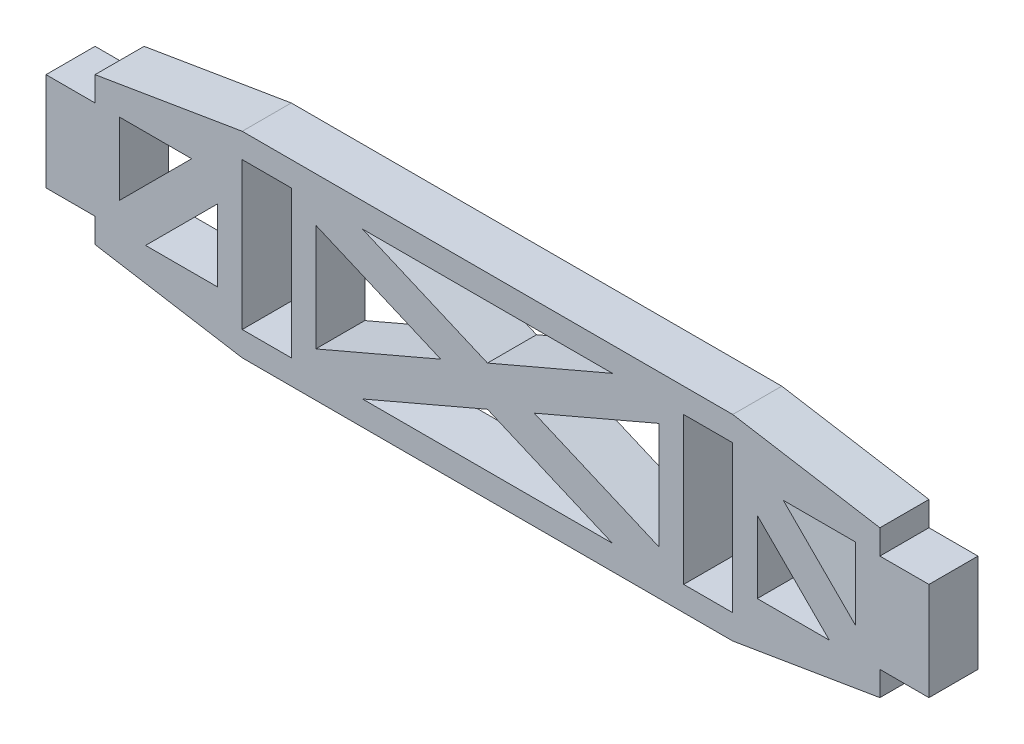
from build123d import *

# Parameters (mm, degrees)
SKETCH1_W           = 6.35
SKETCH1_H           = 19.05
BOSS_EXTRUDE1_DEPTH = 3.175
CUT_EXTRUDE1_DEPTH  = 59.887477446


with BuildPart() as part:
    # Sketch1 → Boss-Extrude1 (new, symmetric)
    with BuildSketch(Plane.XY):
        Polygon((-50.8, -9.525), (-50.8, -6.35), (-57.15, -6.35), (-57.15, 6.35), (-50.8, 6.35), (-50.8, 9.525), (-31.75, 12.7), (31.75, 12.7), (50.8, 9.525), (50.8, 6.35), (57.15, 6.35), (57.15, -6.35), (50.8, -6.35), (50.8, -9.525), (31.75, -12.7), (-31.75, -12.7), align=None)
        with Locations((-28.575, 0)):
            Rectangle(SKETCH1_W, SKETCH1_H, mode=Mode.SUBTRACT)
        with Locations((28.575, 0)):
            Rectangle(SKETCH1_W, SKETCH1_H, mode=Mode.SUBTRACT)
    extrude(amount=BOSS_EXTRUDE1_DEPTH, both=True)

    # Sketch2 → Cut-Extrude1 (cut, through all)
    with BuildSketch(Plane.XY.offset(3.175)):
        Polygon((-38.292596045, 6.35), (-47.625, 6.35), (-47.625, -2.982403955), align=None)
        Polygon((-34.925, 2.982403955), (-44.257403955, -6.35), (-34.925, -6.35), align=None)
        Polygon((-16.179980097, -9.525), (16.179980097, -9.525), (0, -2.590722815), align=None)
        Polygon((6.045019903, 0), (22.225, -6.934277185), (22.225, 6.934277185), align=None)
        Polygon((-22.225, -6.934277185), (-6.045019903, 0), (-22.225, 6.934277185), align=None)
        Polygon((-16.179980097, 9.525), (0, 2.590722815), (16.179980097, 9.525), align=None)
        Polygon((47.625, 6.35), (38.292596045, 6.35), (47.625, -2.982403955), align=None)
        Polygon((44.257403955, -6.35), (34.925, 2.982403955), (34.925, -6.35), align=None)
    extrude(amount=-CUT_EXTRUDE1_DEPTH, mode=Mode.SUBTRACT)


solid = part.part
